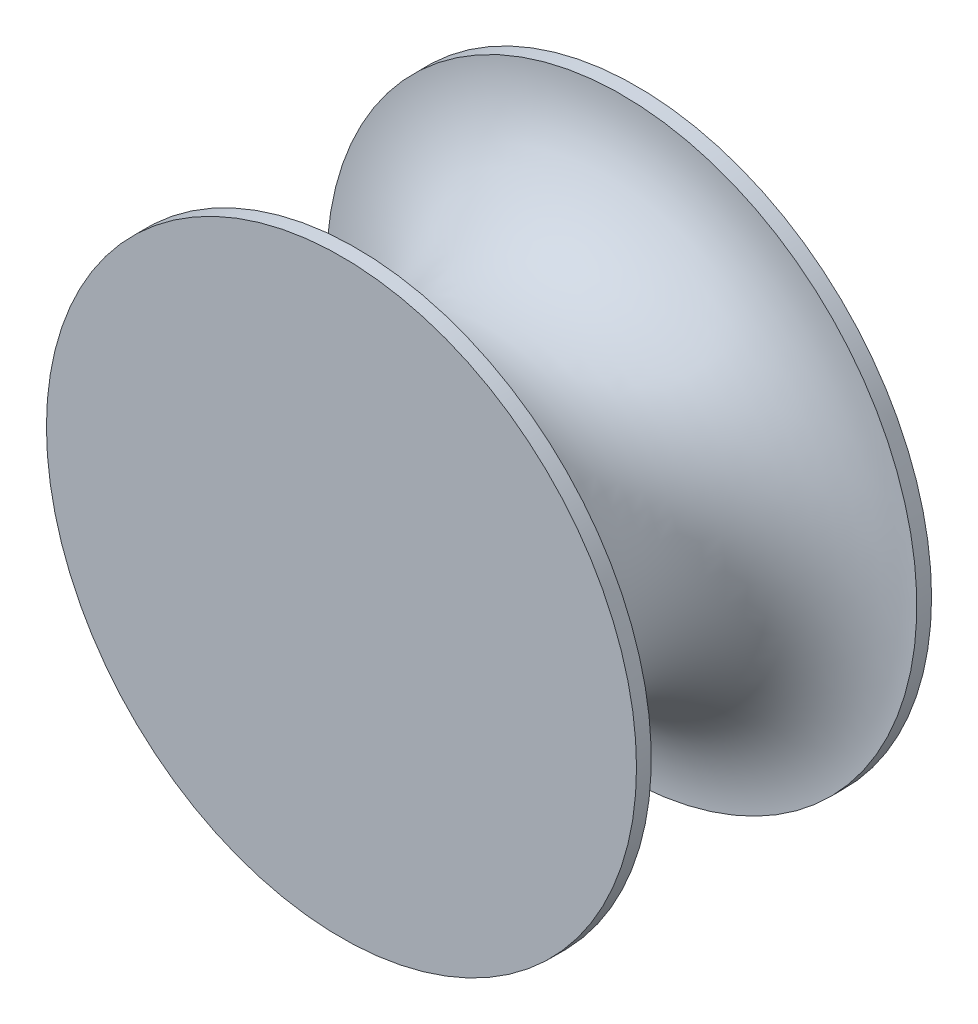
from build123d import *

# Parameters (mm, degrees)
SKETCH1_R           = 12.7
BOSS_EXTRUDE1_DEPTH = 12.7
SKETCH4_R           = 7.62
BOSS_EXTRUDE2_DEPTH = 2.54


with BuildPart() as part:
    # Sketch1 → Boss-Extrude1 (new body)
    with BuildSketch(Plane.XY):
        Circle(SKETCH1_R)
    extrude(amount=BOSS_EXTRUDE1_DEPTH)

    # Sketch2 → Cut-Revolve1 (revolve, cut)
    with BuildSketch(Plane(origin=(0, 0, 0), x_dir=(0, 0, -1), z_dir=(1, 0, 0)), mode=Mode.PRIVATE) as cut_revolve1_sk:
        with BuildLine():
            Line((-12.065, 12.7), (-0.635, 12.7))
            ThreePointArc((-0.635, 12.7), (-6.35, 6.985), (-12.065, 12.7))
        make_face()
    revolve(cut_revolve1_sk.sketch.rotate(Axis((0, 0, 6.35), (0, 0, 1)), 90), axis=Axis((0, 0, 6.35), (0, 0, 1)), mode=Mode.SUBTRACT)

    # Sketch4 → Boss-Extrude2 (add)
    with BuildSketch(Plane(origin=(0, 0, 0), x_dir=(-1, 0, 0), z_dir=(0, 0, -1))):
        Circle(SKETCH4_R)
    extrude(amount=BOSS_EXTRUDE2_DEPTH)


solid = part.part
